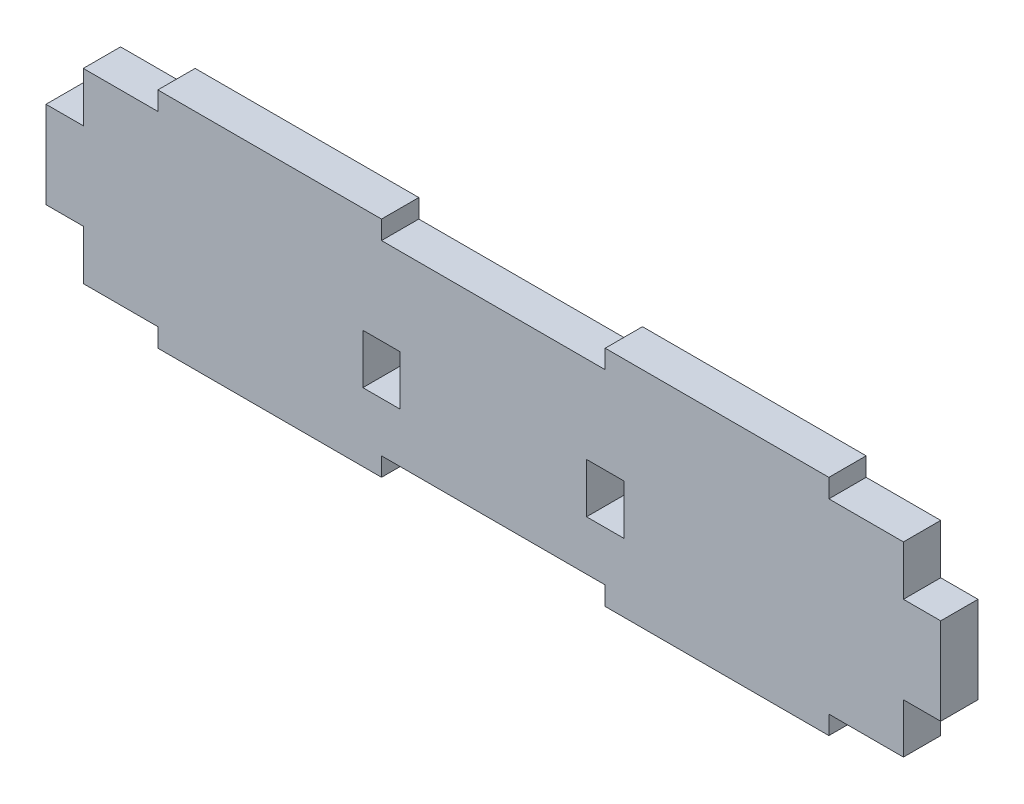
from build123d import *

# Parameters (mm, degrees)
SKETCH1_W           = 304.8
SKETCH1_H           = 63.5
BOSS_EXTRUDE1_DEPTH = 12.7
SKETCH2_W           = 76.2
SKETCH2_H           = 6.35
BOSS_EXTRUDE2_DEPTH = 12.7
SKETCH3_W           = 12.7
SKETCH3_H           = 16.933333333
SKETCH3_H_2         = 16.933333334
CUT_EXTRUDE1_DEPTH  = 158.602855304


with BuildPart() as part:
    # Sketch1 → Boss-Extrude1 (new body)
    with BuildSketch(Plane.XY):
        Rectangle(SKETCH1_W, SKETCH1_H)
    extrude(amount=BOSS_EXTRUDE1_DEPTH)

    # Sketch2 → Boss-Extrude2 (add)
    with BuildSketch(Plane.XY.offset(12.7)):
        with Locations((-76.2, -34.925)):
            Rectangle(SKETCH2_W, SKETCH2_H)
        with Locations((76.2, -34.925)):
            Rectangle(SKETCH2_W, SKETCH2_H)
        with Locations((76.2, 34.925)):
            Rectangle(SKETCH2_W, SKETCH2_H)
        with Locations((-76.2, 34.925)):
            Rectangle(SKETCH2_W, SKETCH2_H)
    extrude(amount=-BOSS_EXTRUDE2_DEPTH)

    # Sketch3 → Cut-Extrude1 (cut, through all)
    with BuildSketch(Plane.XY.offset(12.7)):
        with Locations((-146.05, -23.283333334)):
            Rectangle(SKETCH3_W, SKETCH3_H)
        with Locations((-146.05, 23.283333334)):
            Rectangle(SKETCH3_W, SKETCH3_H)
        with Locations((146.05, 23.283333334)):
            Rectangle(SKETCH3_W, SKETCH3_H)
        with Locations((146.05, -23.283333334)):
            Rectangle(SKETCH3_W, SKETCH3_H)
        with Locations((38.1, -6.35)):
            Rectangle(SKETCH3_W, SKETCH3_H_2)
        with Locations((-38.1, -6.35)):
            Rectangle(SKETCH3_W, SKETCH3_H_2)
    extrude(amount=-CUT_EXTRUDE1_DEPTH, mode=Mode.SUBTRACT)


solid = part.part
